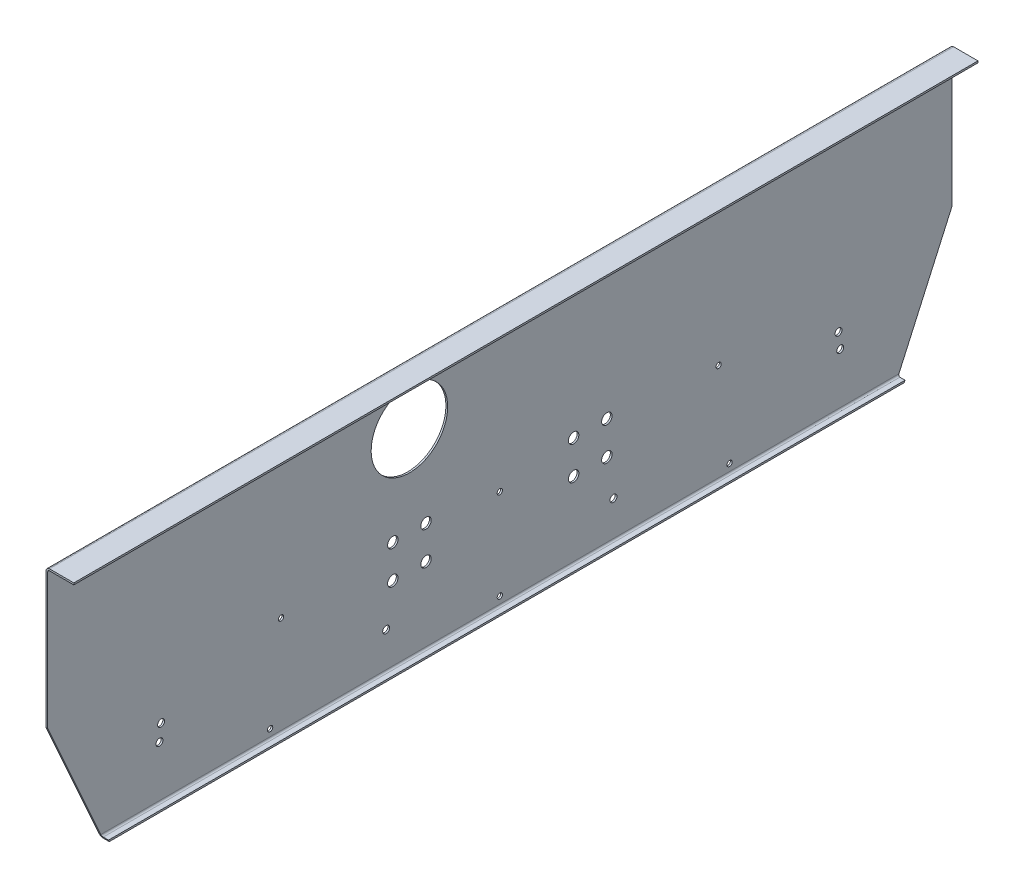
from build123d import *

# Parameters (mm, degrees)
BASE_FLANGE2_DEPTH = 825.5
SKETCH1_R          = 3.175
SKETCH1_R_2        = 2.413
SKETCH1_R_3        = 4.7625
SKETCH1_R_4        = 34.925
CUT_EXTRUDE3_DEPTH = 859.694710551


# Sheet-metal steps are written as plain solids
with BuildPart() as part:
    # Sketch3 → Base-Flange2 (new body)
    with BuildSketch(Plane.XY):
        with BuildLine():
            Line((3.175, 233.4895), (25.4, 233.4895))
            Line((25.4, 233.4895), (25.4, 235.077))
            Line((25.4, 235.077), (3.175, 235.077))
            ThreePointArc((3.175, 235.077), (0.92993597, 234.14706403), (0, 231.902))
            Line((0, 231.902), (0, 0))
            ThreePointArc((0, 0), (0.92993597, -2.24506403), (3.175, -3.175))
            Line((3.175, -3.175), (7.9375, -3.175))
            Line((7.9375, -3.175), (7.9375, -1.5875))
            Line((7.9375, -1.5875), (3.175, -1.5875))
            ThreePointArc((3.175, -1.5875), (2.052467985, -1.122532015), (1.5875, 0))
            Line((1.5875, 0), (1.5875, 231.902))
            ThreePointArc((1.5875, 231.902), (2.052467985, 233.024532015), (3.175, 233.4895))
        make_face()
    extrude(amount=-BASE_FLANGE2_DEPTH)

    # Sketch1 → Cut-Extrude3 (cut, through all)
    with BuildSketch(Plane(origin=(0, 0, 0), x_dir=(0, 0, -1), z_dir=(1, 0, 0))):
        with Locations(Location((516.509, 31.75, 0), (0, 0, 90))):
            Circle(SKETCH1_R)
        with Locations(Location((308.991, 31.75, 0), (0, 0, 90))):
            Circle(SKETCH1_R)
        with Locations(Location((103.492550911, 60.630923565, 0), (0, 0, 90))):
            Circle(SKETCH1_R)
        with Locations(Location((722.007449089, 60.630923565, 0), (0, 0, 90))):
            Circle(SKETCH1_R)
        with Locations(Location((412.75, 6.35, 0), (0, 0, 90))):
            Circle(SKETCH1_R_2)
        with Locations(Location((412.75, 88.9, 0), (0, 0, 90))):
            Circle(SKETCH1_R_2)
        with Locations(Location((622.478249316, 6.35, 0), (0, 0, 90))):
            Circle(SKETCH1_R_2)
        with Locations(Location((612.465522577, 88.9, 0), (0, 0, 90))):
            Circle(SKETCH1_R_2)
        with Locations(Location((203.021750684, 6.35, 0), (0, 0, 90))):
            Circle(SKETCH1_R_2)
        with Locations(Location((101.978503418, 46.225723918, 0), (0, 0, 90))):
            Circle(SKETCH1_R)
        with Locations(Location((723.521496582, 46.225723918, 0), (0, 0, 90))):
            Circle(SKETCH1_R)
        with Locations(Location((213.034477423, 88.9, 0), (0, 0, 90))):
            Circle(SKETCH1_R_2)
        with Locations(Location((510.45745, 97.70745, 0), (0, 0, 90))):
            Circle(SKETCH1_R_3)
        with Locations(Location((480.14255, 97.70745, 0), (0, 0, 90))):
            Circle(SKETCH1_R_3)
        with Locations(Location((480.14255, 67.39255, 0), (0, 0, 90))):
            Circle(SKETCH1_R_3)
        with Locations(Location((510.45745, 67.39255, 0), (0, 0, 90))):
            Circle(SKETCH1_R_3)
        with Locations(Location((345.35745, 97.70745, 0), (0, 0, 90))):
            Circle(SKETCH1_R_3)
        with Locations(Location((315.04255, 97.70745, 0), (0, 0, 90))):
            Circle(SKETCH1_R_3)
        with Locations(Location((345.35745, 67.39255, 0), (0, 0, 90))):
            Circle(SKETCH1_R_3)
        with Locations(Location((315.04255, 67.39255, 0), (0, 0, 90))):
            Circle(SKETCH1_R_3)
        with Locations(Location((330.2, 179.961124202, 0), (0, 0, 90))):
            Circle(SKETCH1_R_4)
        Polygon((775.673017562, -3.175), (825.5, 107.95), (825.5, -3.175), align=None)
        Polygon((0, 107.95), (0, -3.175), (49.826982438, -3.175), align=None)
    extrude(amount=CUT_EXTRUDE3_DEPTH, mode=Mode.SUBTRACT)


solid = part.part
